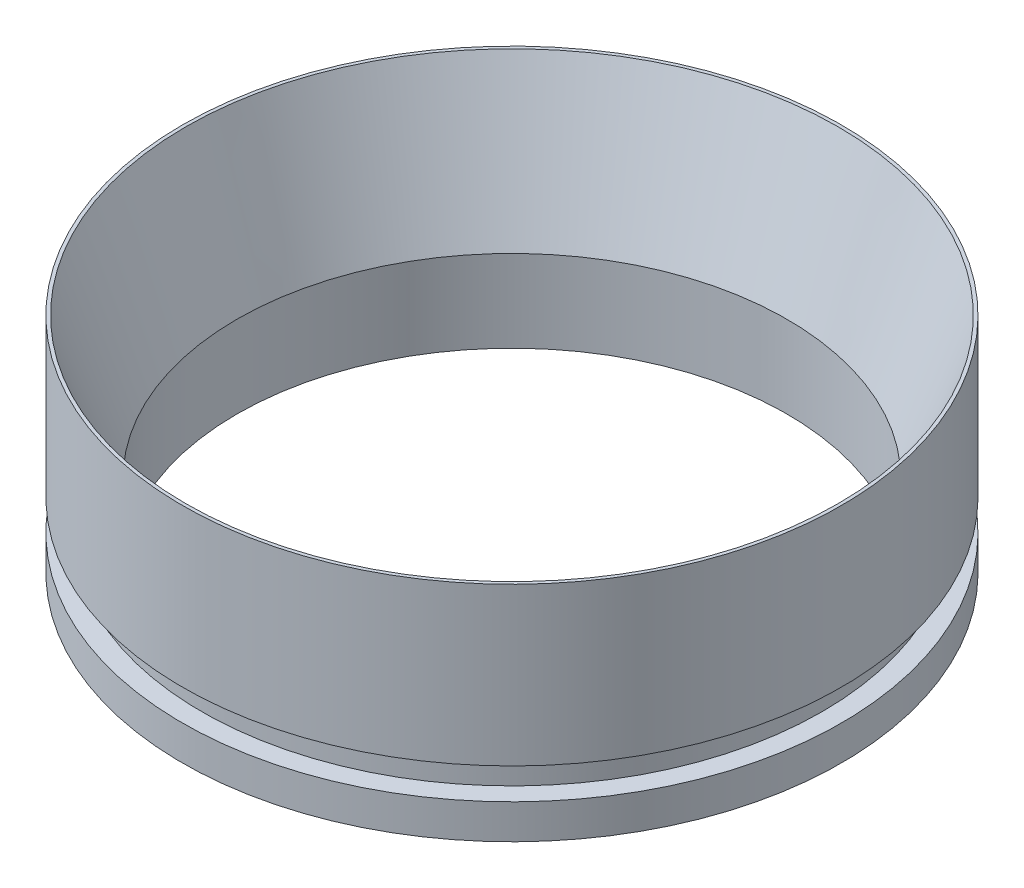
from build123d import *


with BuildPart() as part:
    # Sketch1 → Revolve1 (revolve)
    with BuildSketch(Plane.XY):
        Polygon((50.4825, 34.508102017), (42.545, 12.7), (42.545, 0), (50.9905, 0), (50.9905, 5.3594), (47.9806, 5.3594), (47.9806, 10.16), (50.9905, 10.16), (50.9905, 34.508102017), align=None)
    revolve(axis=Axis((0, 35.903820546, 0), (0, -1, 0)))


solid = part.part
